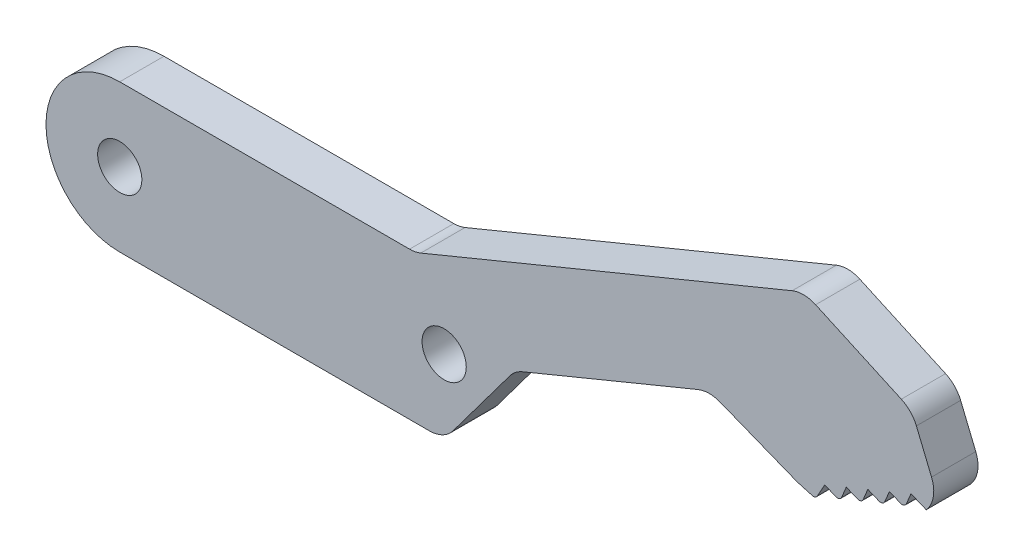
from build123d import *

# Parameters (mm, degrees)
SKETCH2_R           = 1.5
BOSS_EXTRUDE1_DEPTH = 3
FILLET1_START       = -1
FILLET1_DEPTH       = 5
FILLET1_2_DEPTH     = 3
FILLET2_R           = 0.3


with BuildPart() as part:
    # Sketch2 → Boss-Extrude1 (new body)
    with BuildSketch(Plane.XY):
        with BuildLine():
            Line((20.05, 5), (0, 5))
            ThreePointArc((0, 5), (-5, 0), (0, -5))
            Line((0, -5), (22, -5))
            Line((22, -5), (26.795441544, 1.415535375))
            Line((26.795441544, 1.415535375), (39.960977063, 6.841977535))
            Line((39.960977063, 6.841977535), (45.957673933, 4.467717283))
            Line((45.957673933, 4.467717283), (47.183545432, 4.117717283))
            Line((47.183545432, 4.117717283), (47.806766001, 5.229858036))
            Line((47.806766001, 5.229858036), (48.839161842, 4.800113125))
            Line((48.839161842, 4.800113125), (49.268906753, 5.832508966))
            Line((49.268906753, 5.832508966), (50.301302595, 5.402764054))
            Line((50.301302595, 5.402764054), (50.731047506, 6.435159896))
            Line((50.731047506, 6.435159896), (51.763443347, 6.005414984))
            Line((51.763443347, 6.005414984), (52.193188259, 7.037810826))
            Line((52.193188259, 7.037810826), (53.2255841, 6.608065914))
            Line((53.2255841, 6.608065914), (53.655329011, 7.640461756))
            Line((53.655329011, 7.640461756), (54.687724853, 7.210716844))
            Line((54.687724853, 7.210716844), (55.741112884, 7.640461756))
            Line((55.741112884, 7.640461756), (55.434270778, 8.373688641))
            Line((55.434270778, 8.373688641), (53.719454084, 12.534145792))
            Line((53.719454084, 12.534145792), (46.399561958, 15.860505726))
            Line((46.399561958, 15.860505726), (20.05, 5))
        make_face()
        Circle(SKETCH2_R, mode=Mode.SUBTRACT)
        with Locations((22, 0)):
            Circle(SKETCH2_R, mode=Mode.SUBTRACT)
    extrude(amount=BOSS_EXTRUDE1_DEPTH)

    # Fillet1: read off the stored shape, not the designer's step
    # Fillet1 outline → Fillet1 (cut)
    with BuildSketch(Plane.XY.offset(FILLET1_START)):
        with BuildLine():
            Line((55.434270778, 8.373688641), (55.048718881, 9.309107658))
            ThreePointArc((55.048718881, 9.309107658), (55.170672337, 8.207880564), (54.687724853, 7.210716844))
            Line((54.687724853, 7.210716844), (55.741112884, 7.640461756))
            Line((55.741112884, 7.640461756), (55.434270778, 8.373688641))
        make_face()
        with BuildLine():
            Line((53.719454084, 12.534145792), (52.999247687, 12.861427351))
            ThreePointArc((52.999247687, 12.861427351), (53.610964364, 12.429448634), (54.020911938, 11.802754217))
            Line((54.020911938, 11.802754217), (53.719454084, 12.534145792))
        make_face()
        with BuildLine():
            Line((46.399561958, 15.860505726), (45.598653524, 15.530395091))
            ThreePointArc((45.598653524, 15.530395091), (46.396368341, 15.68098662), (47.188222093, 15.50211691))
            Line((47.188222093, 15.50211691), (46.399561958, 15.860505726))
        make_face()
        with BuildLine():
            Line((22, -5), (22.59991613, -4.197407971))
            ThreePointArc((22.59991613, -4.197407971), (21.893850393, -4.788129741), (20.997975386, -5))
            Line((20.997975386, -5), (22, -5))
        make_face()
    extrude(amount=FILLET1_DEPTH, mode=Mode.SUBTRACT)

    # Fillet1 2 outline → Fillet1 2 (add)
    with BuildSketch(Plane.XY):
        with BuildLine():
            ThreePointArc((20.416130089, 5.150907933), (20.042458039, 5.038089689), (19.653989336, 5))
            Line((19.653989336, 5), (20.05, 5))
            Line((20.05, 5), (20.416130089, 5.150907933))
        make_face()
        with BuildLine():
            ThreePointArc((26.465363358, 0.973943448), (26.841174676, 1.356600864), (27.305163351, 1.625627544))
            Line((27.305163351, 1.625627544), (26.795441544, 1.415535375))
            Line((26.795441544, 1.415535375), (26.465363358, 0.973943448))
        make_face()
        with BuildLine():
            ThreePointArc((39.213895373, 6.534052683), (39.962073605, 6.684911877), (40.712285231, 6.544513587))
            Line((40.712285231, 6.544513587), (39.960977063, 6.841977535))
            Line((39.960977063, 6.841977535), (39.213895373, 6.534052683))
        make_face()
    extrude(amount=FILLET1_2_DEPTH)

    # Fillet2
    fillet2_edges = [part.edges().sort_by_distance(p)[0] for p in [
        (53.2255841, 6.608065914, 1.5),
        (51.763443347, 6.005414984, 1.5),
        (50.301302595, 5.402764054, 1.5),
        (48.839161842, 4.800113125, 1.5),
        (47.183545432, 4.117717283, 1.5),
    ]]
    fillet(fillet2_edges, radius=FILLET2_R)


solid = part.part
